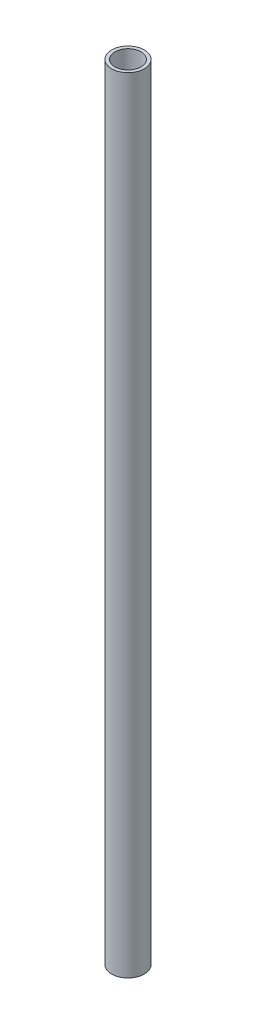
from build123d import *

# Parameters (mm, degrees)
SKETCH1_R           = 5
SKETCH1_R_2         = 4
BOSS_EXTRUDE1_DEPTH = 120


with BuildPart() as part:
    # Sketch1 → Boss-Extrude1 (new, symmetric)
    with BuildSketch(Plane(origin=(0, 0, 0), x_dir=(1, 0, 0), z_dir=(0, 1, 0))):
        Circle(SKETCH1_R)
        Circle(SKETCH1_R_2, mode=Mode.SUBTRACT)
    extrude(amount=BOSS_EXTRUDE1_DEPTH, both=True)


solid = part.part
